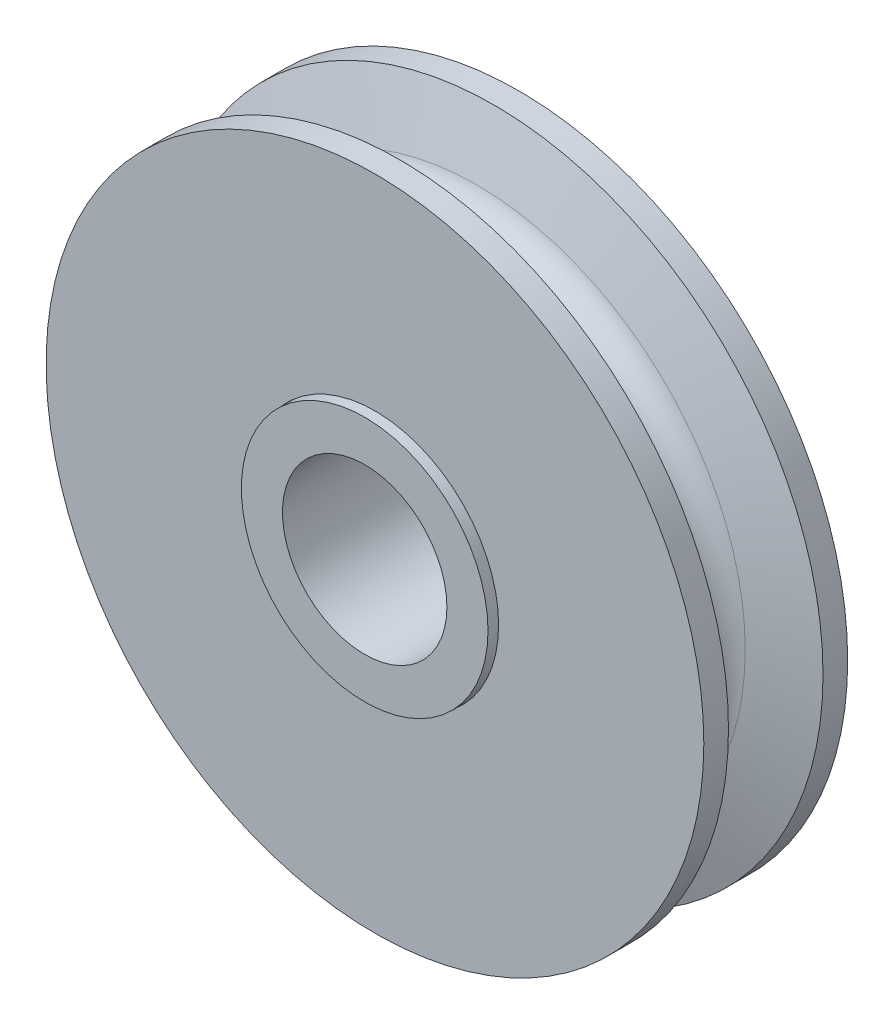
from build123d import *

# Parameters (mm, degrees)
CUT_EXTRUDE_THIN1_DEPTH      = 37.477972806
CUT_EXTRUDE_THIN1_DEPTH_BACK = 37.477972806
SKETCH2_R                    = 9.5504
SKETCH2_R_2                  = 9.525


with BuildPart() as part:
    # Sketch1 → Revolve1 (revolve)
    with BuildSketch(Plane(origin=(0, 0, 0), x_dir=(0, 0, -1), z_dir=(1, 0, 0))):
        with BuildLine():
            Line((3.65125, 25.4), (5.55625, 25.4))
            Line((5.55625, 25.4), (5.55625, 9.525))
            Line((5.55625, 9.525), (6.35, 9.525))
            Line((6.35, 9.525), (6.35, 6.35))
            Line((6.35, 6.35), (-6.35, 6.35))
            Line((-6.35, 6.35), (-6.35, 9.525))
            Line((-6.35, 9.525), (-5.55625, 9.525))
            Line((-5.55625, 9.525), (-5.55625, 25.4))
            Line((-5.55625, 25.4), (-3.65125, 25.4))
            Line((-3.65125, 25.4), (-2.284240955, 20.758498321))
            ThreePointArc((-2.284240955, 20.758498321), (0, 19.05), (2.284240955, 20.758498321))
            Line((2.284240955, 20.758498321), (3.65125, 25.4))
        make_face()
    revolve(axis=Axis((0, 0, 6.35), (0, 0, -1)))

    # Sketch2 → Cut-Extrude-Thin1 (cut, two sides: drawn at the far end of the back side and taken through both)
    with BuildSketch(Plane.XY.offset(-CUT_EXTRUDE_THIN1_DEPTH_BACK)):
        Circle(SKETCH2_R)
        Circle(SKETCH2_R_2, mode=Mode.SUBTRACT)
    extrude(amount=CUT_EXTRUDE_THIN1_DEPTH + CUT_EXTRUDE_THIN1_DEPTH_BACK, mode=Mode.SUBTRACT)


with BuildPart() as cut_extrude_thin1_piece_1:
    # of the separate pieces the step leaves, piece 1, a body of its own (cut_extrude_thin1_pieces)
    add(part.part.solids().sort_by_distance((0, 25.4, -3.65125))[0])


with BuildPart() as cut_extrude_thin1_piece_2:
    # of the separate pieces the step leaves, piece 2, a body of its own (cut_extrude_thin1_pieces)
    add(part.part.solids().sort_by_distance((0, 9.525, -5.55625))[0])


solid = Compound([cut_extrude_thin1_piece_1.part, cut_extrude_thin1_piece_2.part])
